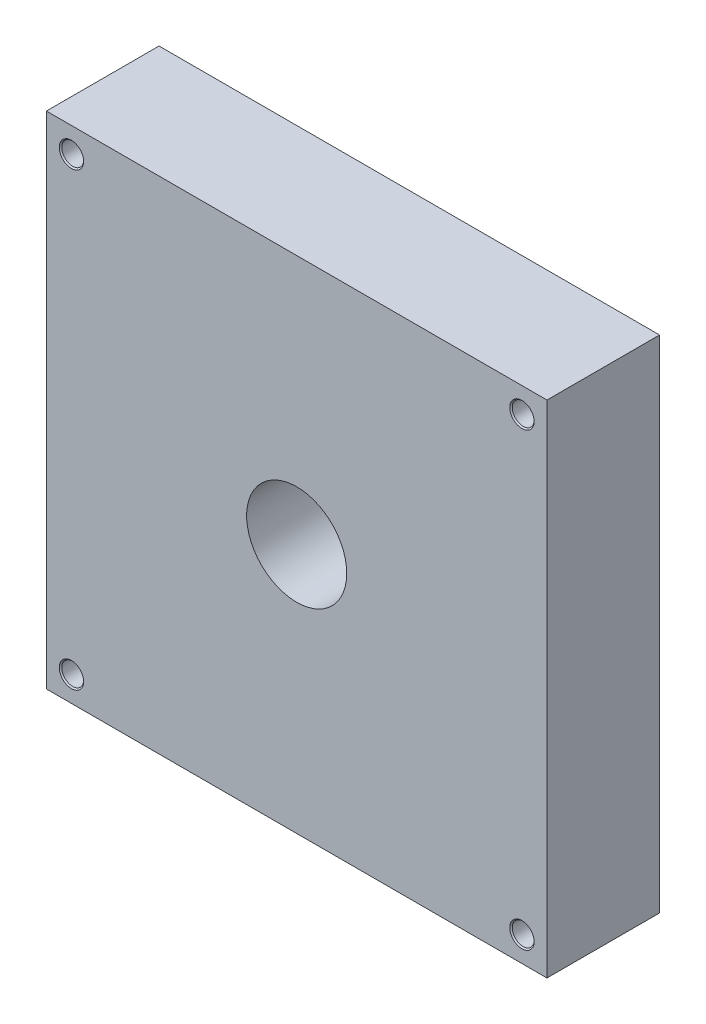
from build123d import *

# Parameters (mm, degrees)
SKETCH1_W                                     = 254
SKETCH1_H                                     = 254
SKETCH1_R                                     = 25.4
BOSS_EXTRUDE1_DEPTH                           = 57.15
CBORE_FOR_1_4_SOCKET_HEAD_CAP_SCREW2_AT_COUNT = 2
CBORE_FOR_1_4_SOCKET_HEAD_CAP_SCREW2_AT_PITCH = 228.6
CBORE_FOR_1_4_SOCKET_HEAD_CAP_SCREW2_2_COUNT  = 2
CBORE_FOR_1_4_SOCKET_HEAD_CAP_SCREW2_2_PITCH  = 323.289220358
CBORE_FOR_1_4_SOCKET_HEAD_CAP_SCREW2_3_COUNT  = 2
CBORE_FOR_1_4_SOCKET_HEAD_CAP_SCREW2_3_PITCH  = 228.6


with BuildPart() as part:
    # Sketch1 → Boss-Extrude1 (new body)
    with BuildSketch(Plane.XY):
        Rectangle(SKETCH1_W, SKETCH1_H)
        Circle(SKETCH1_R, mode=Mode.SUBTRACT)
    extrude(amount=-BOSS_EXTRUDE1_DEPTH)

    # Sketch3 → CBORE for 1/4 Socket Head Cap Screw2 (revolve, cut)
    with BuildSketch(Plane(origin=(-114.3, 114.3, 0), x_dir=(0, -1, 0), z_dir=(1, 0, 0))):
        Polygon((0, 0), (0, 57.15), (3.8989, 57.15), (3.2639, 56.515), (3.2639, 50.8), (5.55625, 50.8), (5.55625, 0.635), (6.19125, 0), align=None)
    cbore_for_1_4_socket_head_cap_screw2 = revolve(axis=Axis((-114.3, 114.3, 6.35), (0, 0, -1)), mode=Mode.SUBTRACT)

    # CBORE for 1/4 Socket Head Cap Screw2 at: CBORE for 1/4 Socket Head Cap Screw2 ×2
    with Locations(*[(i * CBORE_FOR_1_4_SOCKET_HEAD_CAP_SCREW2_AT_PITCH, 0, 0) for i in range(1, CBORE_FOR_1_4_SOCKET_HEAD_CAP_SCREW2_AT_COUNT)]):
        add(cbore_for_1_4_socket_head_cap_screw2, mode=Mode.SUBTRACT)

    # CBORE for 1_4 Socket Head Cap Screw2 2: CBORE for 1/4 Socket Head Cap Screw2 ×2
    with Locations(*[Vector(0.7071067811865476, -0.7071067811865476, 0) * (i * CBORE_FOR_1_4_SOCKET_HEAD_CAP_SCREW2_2_PITCH) for i in range(1, CBORE_FOR_1_4_SOCKET_HEAD_CAP_SCREW2_2_COUNT)]):
        add(cbore_for_1_4_socket_head_cap_screw2, mode=Mode.SUBTRACT)

    # CBORE for 1_4 Socket Head Cap Screw2 3: CBORE for 1/4 Socket Head Cap Screw2 ×2
    with Locations(*[(0, -i * CBORE_FOR_1_4_SOCKET_HEAD_CAP_SCREW2_3_PITCH, 0) for i in range(1, CBORE_FOR_1_4_SOCKET_HEAD_CAP_SCREW2_3_COUNT)]):
        add(cbore_for_1_4_socket_head_cap_screw2, mode=Mode.SUBTRACT)


solid = part.part
